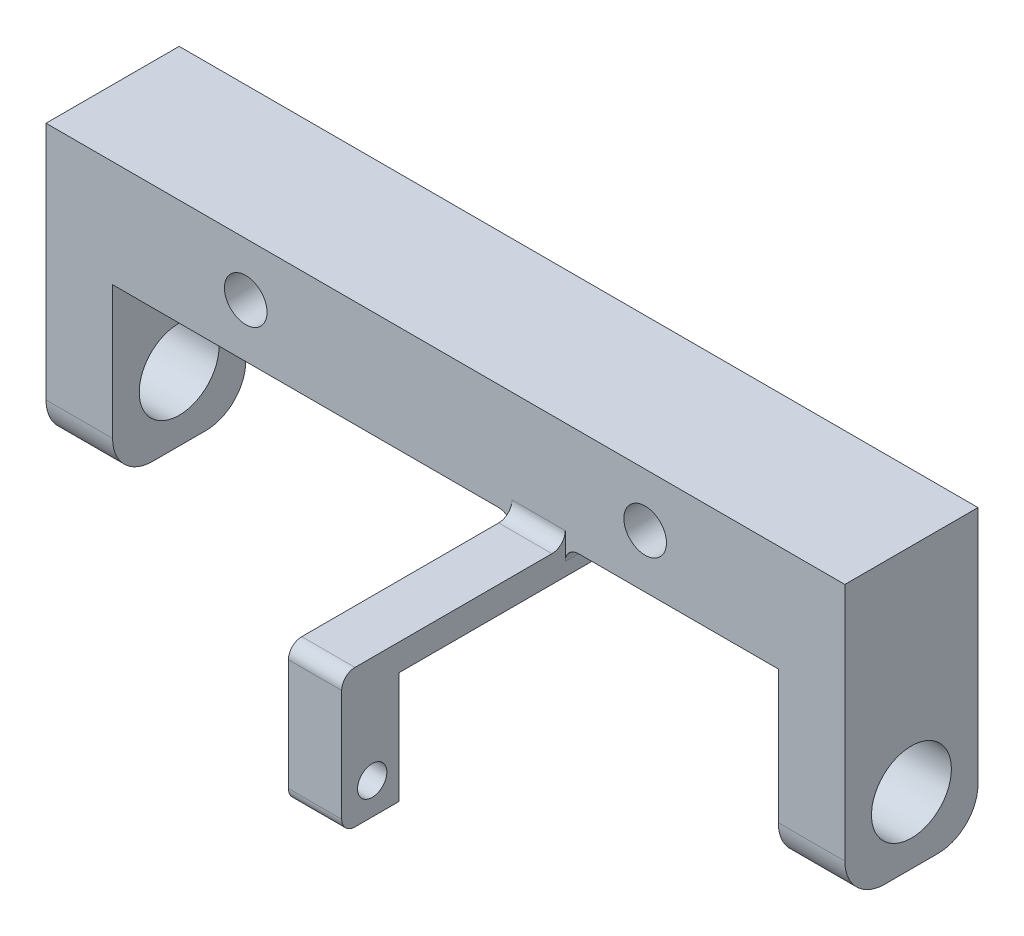
from build123d import *

# Parameters (mm, degrees)
SKETCH_1_W               = 60
SKETCH_1_H               = 10
EXTRUDE_1_DEPTH          = 8
SKETCH_2_W               = 10
SKETCH_2_H               = 21
SKETCH_2_R               = 3
EXTRUDE_2_DEPTH          = 5
FILLET_1_R               = 3
SKETCH_3_R               = 1.1
EXTRUDE_3_DEPTH          = 4
FILLET_3_R               = 1
FILLET_4_R               = 1
CUT_EXTRUDE_1_DEPTH      = 37.755985178
CUT_EXTRUDE_1_DEPTH_BACK = 37.755985178
SKETCH_4_R               = 1.6


with BuildPart() as part:
    # 草图1 → 凸台-拉伸1 (new body)
    with BuildSketch(Plane(origin=(0, 0, 0), x_dir=(1, 0, 0), z_dir=(0, 1, 0))):
        Rectangle(SKETCH_1_W, SKETCH_1_H)
    extrude(amount=EXTRUDE_1_DEPTH)

    # 草图2 → 凸台-拉伸2 (add)
    with BuildSketch(Plane(origin=(30, 0, 0), x_dir=(0, 0, -1), z_dir=(1, 0, 0))):
        with Locations((0, -2.5)):
            Rectangle(SKETCH_2_W, SKETCH_2_H)
        with Locations((0, -8)):
            Circle(SKETCH_2_R, mode=Mode.SUBTRACT)
    extrude_2 = extrude(amount=-EXTRUDE_2_DEPTH)

    # 镜向1: 凸台-拉伸2 across plane
    add(extrude_2.mirror(Plane(origin=(0, 0, 0), x_dir=(0, 0, 1), z_dir=(1, 0, 0))))

    # 圆角1
    fillet_1_edges = [part.edges().sort_by_distance(p)[0] for p in [
        (-27.5, -13, -5),
        (-27.5, -13, 5),
        (27.5, -13, -5),
        (27.5, -13, 5),
    ]]
    fillet(fillet_1_edges, radius=FILLET_1_R)

    # 草图3 → 凸台-拉伸3 (add)
    with BuildSketch(Plane.ZY.offset(-5)):
        Polygon((-6.5, -2), (17.5, -2), (17.5, -8), (17.5, -10.376383694), (21.792928464, -10.376383694), (21.792928464, 0), (-10.867924675, 0), (-10.867924675, -10.376383694), (-6.5, -10.376383694), (-6.5, -8), align=None)
        with Locations((-8.5, -8)):
            Circle(SKETCH_3_R, mode=Mode.SUBTRACT)
        with Locations((19.5, -8)):
            Circle(SKETCH_3_R, mode=Mode.SUBTRACT)
    extrude(amount=-EXTRUDE_3_DEPTH)

    # 圆角3
    fillet_3_edges = [part.edges().sort_by_distance(p)[0] for p in [
        (7, -10.376383694, -10.867924675),
        (7, 0, -10.867924675),
        (7, -10.376383694, 21.792928464),
        (7, 0, 21.792928464),
        (7, 0, -5),
        (7, 0, 5),
    ]]
    fillet(fillet_3_edges, radius=FILLET_3_R)

    # 圆角4
    fillet_4_edges = [part.edges().sort_by_distance(p)[0] for p in [
        (9, 0, 0),
        (5, 0, 0),
    ]]
    fillet(fillet_4_edges, radius=FILLET_4_R)

    # 草图4 → 切除-拉伸1 (cut, two sides: drawn at the far end of the back side and taken through both)
    with BuildSketch(Plane.XY.offset(5).offset(-CUT_EXTRUDE_1_DEPTH_BACK)):
        with Locations((-15, 4)):
            Circle(SKETCH_4_R)
        with Locations((15, 4)):
            Circle(SKETCH_4_R)
    extrude(amount=CUT_EXTRUDE_1_DEPTH + CUT_EXTRUDE_1_DEPTH_BACK, mode=Mode.SUBTRACT)


solid = part.part
